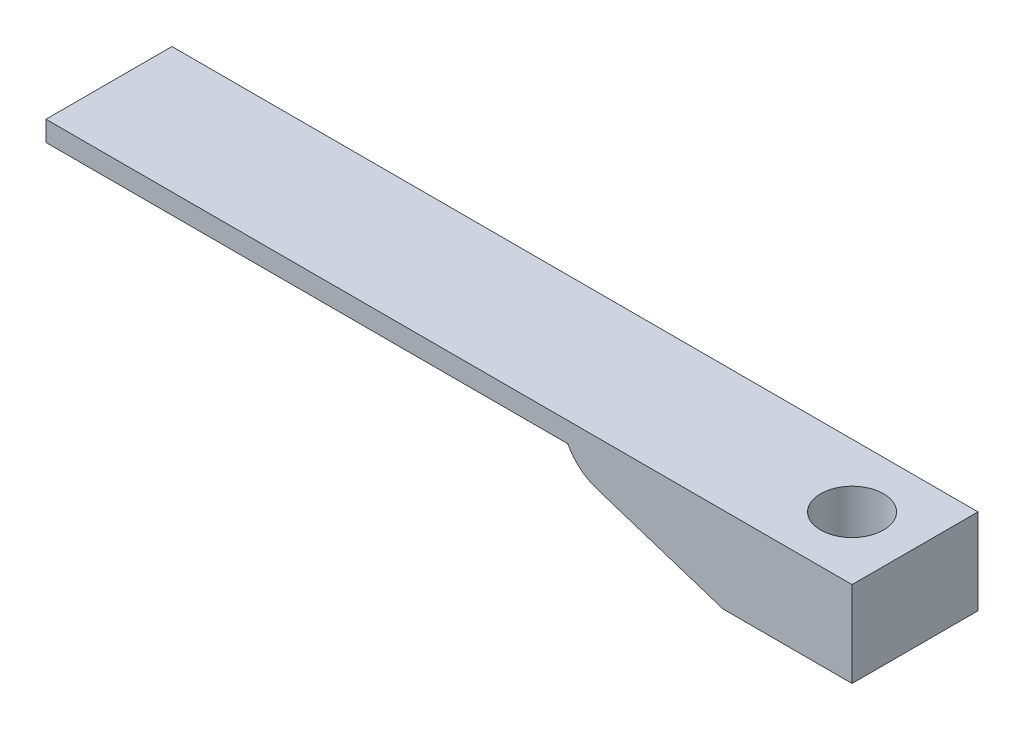
from build123d import *
from build123d.topology import SkipClean

# Parameters (mm, degrees)
SKETCH1_W           = 160
SKETCH1_H           = 25
SKETCH1_R           = 6.25
BOSS_EXTRUDE1_DEPTH = 4
BOSS_EXTRUDE2_START = 13
SKETCH2_W           = 56.41
SKETCH2_H           = 25
SKETCH2_R           = 6.25
BOSS_EXTRUDE2_DEPTH = 13
CHAMFER1_SIZE       = 10
CHAMFER1_SIZE2      = 30.776835372
FILLET1_R           = 10


with BuildPart() as part:
    # Sketch1 → Boss-Extrude1 (new body)
    with BuildSketch(Plane(origin=(0, 0, 0), x_dir=(1, 0, 0), z_dir=(0, 1, 0))):
        Rectangle(SKETCH1_W, SKETCH1_H)
        with Locations(Location((67.5, 0, 0), (0, 0, 270))):
            Circle(SKETCH1_R, mode=Mode.SUBTRACT)
    extrude(amount=BOSS_EXTRUDE1_DEPTH)

    # Sketch2 → Boss-Extrude2 (add)
    with SkipClean():  # the faces are left unmerged after this step: merging them gives an invalid solid
        with BuildSketch(Plane.XZ.offset(BOSS_EXTRUDE2_START)):
            with Locations((51.795, 0)):
                Rectangle(SKETCH2_W, SKETCH2_H)
            with Locations((67.5, 0)):
                Circle(SKETCH2_R, mode=Mode.SUBTRACT)
        extrude(amount=-BOSS_EXTRUDE2_DEPTH)

    # Chamfer1
    chamfer1_edges = [part.edges().sort_by_distance(p)[0] for p in [
        (23.59, -13, 0),
    ]]
    chamfer1_side = [part.faces().sort_by_distance(p)[0] for p in [
        (23.59, -6.5, 0),
    ]]
    chamfer(chamfer1_edges, length=CHAMFER1_SIZE, length2=CHAMFER1_SIZE2, reference=chamfer1_side[0])

    # Fillet1
    # the kernel refuses this fillet: 10 mm, written as the material it takes off along each edge
    with BuildSketch(Plane(origin=(23.59, -3, 27.668583986), x_dir=(0.9510565162951544, -0.3090169943749446, 0), z_dir=(0, 0, -1))) as fillet1_piece_1:
        with BuildLine():
            CenterArc((6.067433594, -10), FILLET1_R, 90, 44.38277042)
            Line((-0.927050983, -2.853169549), (-1.066940675, -2.71023294))
            ThreePointArc((-1.066940675, -2.71023294), (-0.653736795, -1.364781376), (-0.190211303, 0.061803399))
            Line((-0.190211303, 0.061803399), (0, 0.2))
            Line((0, 0.2), (6.067433594, 0.2))
            Line((6.067433594, 0.2), (6.067433594, 0))
        make_face()
    extrude(amount=55.337167971, mode=Mode.SUBTRACT)


solid = part.part
